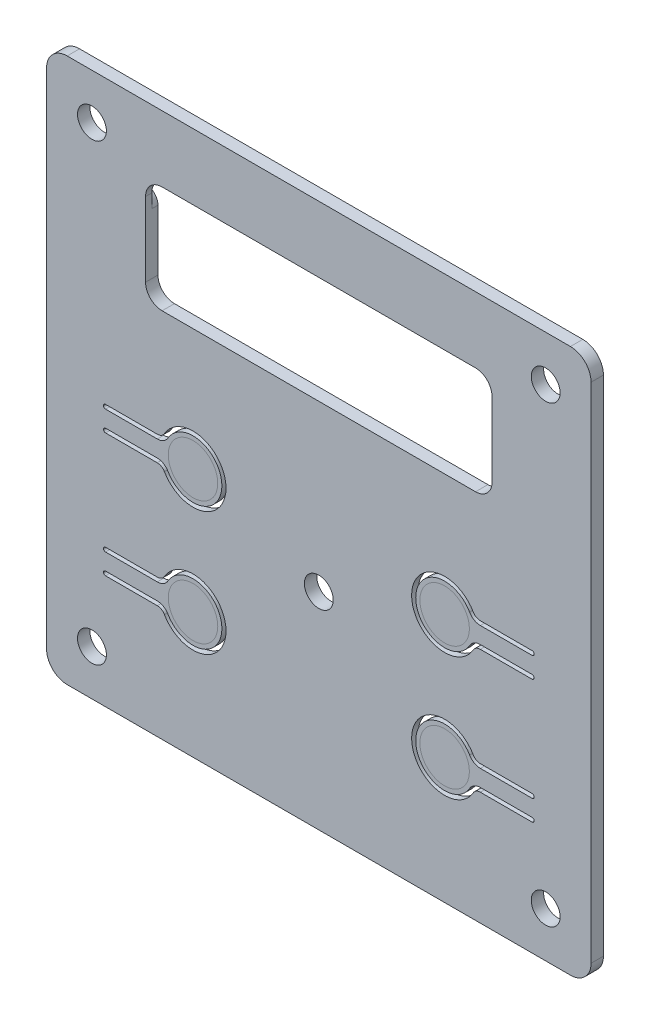
from build123d import *

# Parameters (mm, degrees)
SKETCH_1_W             = 132
SKETCH_1_H             = 132
SKETCH_1_R             = 3.5
EXTRUDE_1_DEPTH        = 3
FILLET_1_R             = 5
CUT_EXTRUDE_1_DEPTH    = 94.386294498
FILLET_2_R             = 0.5
FILLET_2_OF_MIRROR_1_R = 0.5
MIRROR_2_DEPTH         = 3
CUT_EXTRUDE_START      = -1.450001
SKETCH_4_R             = 12.5
CUT_EXTRUDE_2_DEPTH    = 1.450001
CUT_EXTRUDE_START_2    = -1.450002
CUT_EXTRUDE_3_DEPTH    = 1.450002
FILLET_3_R             = 1
CUT_EXTRUDE_4_DEPTH    = 94.386294498
SKETCH_7_R             = 4
CUT_EXTRUDE_5_DEPTH    = 1.5
FILLET_4_R             = 3


# Read off the part's stored shape, not the designer's step: Зеркальное отражение2
# Some blends are built 0.0001 mm under size
with BuildPart() as part:
    # Эскиз1 → Бобышка-Вытянуть1 (new body)
    with BuildSketch(Plane.XY):
        Rectangle(SKETCH_1_W, SKETCH_1_H)
        with Locations((-55, 55)):
            Circle(SKETCH_1_R, mode=Mode.SUBTRACT)
        with Locations((55, 55)):
            Circle(SKETCH_1_R, mode=Mode.SUBTRACT)
        with Locations((55, -55)):
            Circle(SKETCH_1_R, mode=Mode.SUBTRACT)
        with Locations((-55, -55)):
            Circle(SKETCH_1_R, mode=Mode.SUBTRACT)
        with Locations((0, -16)):
            Circle(SKETCH_1_R, mode=Mode.SUBTRACT)
    extrude(amount=EXTRUDE_1_DEPTH)

    # Скругление1
    fillet_1_edges = [part.edges().sort_by_distance(p)[0] for p in [
        (-66, 66, 1.5),
        (66, 66, 1.5),
        (66, -66, 1.5),
        (-66, -66, 1.5),
    ]]
    fillet(fillet_1_edges, radius=FILLET_1_R)

    # Эскиз3 → Вырез-Вытянуть1 (cut, through all)
    with BuildSketch(Plane.XY.offset(3)):
        with BuildLine():
            Line((-39.160131968, -3.499931335), (-52.208081862, -3.499931335))
            Line((-52.208081862, -3.499931335), (-52.208081862, -2.499931335))
            Line((-52.208081862, -2.499931335), (-39.160131968, -2.499931335))
            ThreePointArc((-39.160131968, -2.499931335), (-38.160131968, -2.231982143), (-37.42808116, -1.499931335))
            ThreePointArc((-37.42808116, -1.499931335), (-22.49987793, -5.499931335), (-37.42808116, -9.499931335))
            ThreePointArc((-37.42808116, -9.499931335), (-38.160131968, -8.767880528), (-39.160131968, -8.499931335))
            Line((-39.160131968, -8.499931335), (-52.208081862, -8.499931335))
            Line((-52.208081862, -8.499931335), (-52.208081862, -7.499931335))
            Line((-52.208081862, -7.499931335), (-39.160131968, -7.499931335))
            ThreePointArc((-39.160131968, -7.499931335), (-37.660131968, -7.901855124), (-36.562055756, -8.999931335))
            ThreePointArc((-36.562055756, -8.999931335), (-23.49987793, -5.499931335), (-36.562055756, -1.999931335))
            ThreePointArc((-36.562055756, -1.999931335), (-37.660131968, -3.098007547), (-39.160131968, -3.499931335))
        make_face()
    cut_extrude_1 = extrude(amount=-CUT_EXTRUDE_1_DEPTH, mode=Mode.SUBTRACT)

    # Скругление2
    fillet_2_edges = [part.edges().sort_by_distance(p)[0] for p in [
        (-52.208081862, -7.499931335, 1.5),
        (-52.208081862, -2.499931335, 1.5),
        (-52.208081862, -8.499931335, 1.5),
        (-52.208081862, -3.499931335, 1.5),
    ]]
    fillet(fillet_2_edges, radius=FILLET_2_R - 0.0001)  # a hair under: the kernel refuses the full size

    # Зеркальное отражение1: Вырез-Вытянуть1 across plane
    add(cut_extrude_1.mirror(Plane(origin=(0, 0, 0), x_dir=(0, 0, 1), z_dir=(1, 0, 0))), mode=Mode.SUBTRACT)

    # Скругление2 of Зеркальное отражение1
    fillet_2_of_mirror_1_edges = [part.edges().sort_by_distance(p)[0] for p in [
        (52.208081862, -7.499931335, 1.5),
        (52.208081862, -2.499931335, 1.5),
        (52.208081862, -8.499931335, 1.5),
        (52.208081862, -3.499931335, 1.5),
    ]]
    fillet(fillet_2_of_mirror_1_edges, radius=FILLET_2_OF_MIRROR_1_R - 0.0001)  # a hair under: the kernel refuses the full size

    # Зеркальное отражение2 outline → Зеркальное отражение2 (cut)
    with BuildSketch(Plane.XY):
        with BuildLine():
            ThreePointArc((37.427771906, -39.501176165), (38.159834629, -38.769137272), (39.15983899, -38.501204355))
            Line((39.15983899, -38.501204355), (51.707788883, -38.501408585))
            ThreePointArc((51.707788883, -38.501408585), (52.061344657, -38.354967731), (52.207797021, -38.001416724))
            ThreePointArc((52.207797021, -38.001416724), (52.061356166, -37.647860949), (51.707805159, -37.501408586))
            Line((51.707805159, -37.501408586), (39.159855266, -37.501204356))
            ThreePointArc((39.159855266, -37.501204356), (37.659848724, -37.90310373), (36.561754641, -39.001162069))
            ThreePointArc((36.561754641, -39.001162069), (23.499633782, -35.500949469), (36.561868573, -32.00116207))
            ThreePointArc((36.561868573, -32.00116207), (37.659926912, -33.099256154), (39.15992037, -33.501204356))
            Line((39.15992037, -33.501204356), (51.707870263, -33.501408586))
            ThreePointArc((51.707870263, -33.501408586), (52.061426037, -33.354967731), (52.207878401, -33.001416724))
            ThreePointArc((52.207878401, -33.001416724), (52.061437546, -32.64786095), (51.707886539, -32.501408586))
            Line((51.707886539, -32.501408586), (39.159936646, -32.501204356))
            ThreePointArc((39.159936646, -32.501204356), (38.159941007, -32.233238888), (37.427902114, -31.501176166))
            ThreePointArc((37.427902114, -31.501176166), (22.499633782, -35.500933194), (37.427771906, -39.501176165))
        make_face()
        with BuildLine():
            Line((-51.708374828, -38.499725387), (-39.160424935, -38.499929618))
            ThreePointArc((-39.160424935, -38.499929618), (-38.160429296, -38.767895086), (-37.428390404, -39.499957808))
            ThreePointArc((-37.428390404, -39.499957808), (-22.500122071, -35.50020078), (-37.428260196, -31.499957809))
            ThreePointArc((-37.428260196, -31.499957809), (-38.160322918, -32.231996702), (-39.160327279, -32.499929618))
            Line((-39.160327279, -32.499929618), (-51.708277172, -32.499725388))
            ThreePointArc((-51.708277172, -32.499725388), (-52.061832946, -32.646166243), (-52.20828531, -32.99971725))
            ThreePointArc((-52.20828531, -32.99971725), (-52.061844455, -33.353273024), (-51.708293448, -33.499725388))
            Line((-51.708293448, -33.499725388), (-39.160343555, -33.499929618))
            ThreePointArc((-39.160343555, -33.499929618), (-37.660337014, -33.098030244), (-36.56224293, -31.999971905))
            ThreePointArc((-36.56224293, -31.999971905), (-23.500122071, -35.500184505), (-36.562356862, -38.999971904))
            ThreePointArc((-36.562356862, -38.999971904), (-37.660415201, -37.90187782), (-39.160408659, -37.499929618))
            Line((-39.160408659, -37.499929618), (-51.708358552, -37.499725388))
            ThreePointArc((-51.708358552, -37.499725388), (-52.061914326, -37.646166243), (-52.20836669, -37.99971725))
            ThreePointArc((-52.20836669, -37.99971725), (-52.061925835, -38.353273024), (-51.708374828, -38.499725387))
        make_face()
    extrude(amount=MIRROR_2_DEPTH, mode=Mode.SUBTRACT)

    # Эскиз4 → Вырез-Вытянуть2 (cut)
    with BuildSketch(Plane(origin=(0, 0, 0), x_dir=(-1, 0, 0), z_dir=(0, 0, -1)).offset(CUT_EXTRUDE_START)):
        with Locations((-30.49987793, -5.499931335)):
            Circle(SKETCH_4_R)
        with Locations((30.50012207, -5.499931335)):
            Circle(SKETCH_4_R)
        with Locations((-30.49987793, -35.500070572)):
            Circle(SKETCH_4_R)
        with Locations((30.50012207, -35.500070572)):
            Circle(SKETCH_4_R)
    extrude(amount=CUT_EXTRUDE_2_DEPTH, mode=Mode.SUBTRACT)

    # Эскиз5 → Вырез-Вытянуть3 (cut)
    with BuildSketch(Plane(origin=(0, 0, 0), x_dir=(-1, 0, 0), z_dir=(0, 0, -1)).offset(CUT_EXTRUDE_START_2)):
        with BuildLine():
            Line((13.924942017, -57.375100136), (8.924942017, -57.375100136))
            ThreePointArc((8.924942017, -57.375100136), (7.174942017, -55.625100136), (8.924942017, -53.875100136))
            Line((8.924942017, -53.875100136), (13.924942017, -53.875100136))
            ThreePointArc((13.924942017, -53.875100136), (15.674942017, -55.625100136), (13.924942017, -57.375100136))
        make_face()
        with BuildLine():
            Line((-2.074954987, -58.825081825), (-4.574954987, -58.825081825))
            ThreePointArc((-4.574954987, -58.825081825), (-6.324954987, -57.075081825), (-4.574954987, -55.325081825))
            Line((-4.574954987, -55.325081825), (-2.074954987, -55.325081825))
            ThreePointArc((-2.074954987, -55.325081825), (-0.324954987, -57.075081825), (-2.074954987, -58.825081825))
        make_face()
        with BuildLine():
            Line((-47.02500206, -33.149315929), (-47.02500206, -40.769315929))
            ThreePointArc((-47.02500206, -40.769315929), (-48.775001727, -42.519316262), (-50.52500206, -40.769315929))
            Line((-50.52500206, -40.769315929), (-50.52500206, -33.149315929))
            ThreePointArc((-50.52500206, -33.149315929), (-48.77500206, -31.399315929), (-47.02500206, -33.149315929))
        make_face()
        with BuildLine():
            Line((-53.130997525, -33.09477642), (-55.670997525, -33.09477642))
            ThreePointArc((-55.670997525, -33.09477642), (-57.420997747, -31.344776642), (-55.670997525, -29.59477642))
            Line((-55.670997525, -29.59477642), (-53.130997525, -29.59477642))
            ThreePointArc((-53.130997525, -29.59477642), (-51.380997525, -31.34477642), (-53.130997525, -33.09477642))
        make_face()
        with BuildLine():
            Line((-11, -11.46), (-13.54, -11.46))
            ThreePointArc((-13.54, -11.46), (-14.954213562, -12.045786438), (-15.54, -13.46))
            Line((-15.54, -13.46), (-15.54, -18.54))
            ThreePointArc((-15.54, -18.54), (-14.954213562, -19.954213562), (-13.54, -20.54))
            Line((-13.54, -20.54), (-11, -20.54))
            ThreePointArc((-11, -20.54), (-9.585786438, -19.954213562), (-9, -18.54))
            Line((-9, -18.54), (-9, -13.46))
            ThreePointArc((-9, -13.46), (-9.585786438, -12.045786438), (-11, -11.46))
        make_face()
        with BuildLine():
            Line((-33, -46.6), (-44, -46.6))
            ThreePointArc((-44, -46.6), (-45.414213562, -47.185786438), (-46, -48.6))
            Line((-46, -48.6), (-46, -51))
            ThreePointArc((-46, -51), (-45.414213562, -52.414213562), (-44, -53))
            Line((-44, -53), (-33, -53))
            ThreePointArc((-33, -53), (-31.585786438, -52.414213562), (-31, -51))
            Line((-31, -51), (-31, -48.6))
            ThreePointArc((-31, -48.6), (-31.585786438, -47.185786438), (-33, -46.6))
        make_face()
        with BuildLine():
            Line((-14.96, -28.25), (-17.5, -28.25))
            ThreePointArc((-17.5, -28.25), (-19.25, -26.5), (-17.5, -24.75))
            Line((-17.5, -24.75), (-14.96, -24.75))
            ThreePointArc((-14.96, -24.75), (-13.21, -26.5), (-14.96, -28.25))
        make_face()
        with BuildLine():
            Line((57, -3), (54.5, -3))
            ThreePointArc((54.5, -3), (53.085786438, -3.585786438), (52.5, -5))
            Line((52.5, -5), (52.5, -22))
            ThreePointArc((52.5, -22), (53.085786438, -23.414213562), (54.5, -24))
            Line((54.5, -24), (57, -24))
            ThreePointArc((57, -24), (58.414213562, -23.414213562), (59, -22))
            Line((59, -22), (59, -5))
            ThreePointArc((59, -5), (58.414213562, -3.585786438), (57, -3))
        make_face()
        with BuildLine():
            Line((56.5, -33.7), (54.5, -33.7))
            ThreePointArc((54.5, -33.7), (53.792893219, -33.992893219), (53.5, -34.7))
            Line((53.5, -34.7), (53.5, -40))
            ThreePointArc((53.5, -40), (53.792893219, -40.707106781), (54.5, -41))
            Line((54.5, -41), (56.5, -41))
            ThreePointArc((56.5, -41), (57.207106781, -40.707106781), (57.5, -40))
            Line((57.5, -40), (57.5, -34.7))
            ThreePointArc((57.5, -34.7), (57.207106781, -33.992893219), (56.5, -33.7))
        make_face()
    extrude(amount=CUT_EXTRUDE_3_DEPTH, mode=Mode.SUBTRACT)

    # Скругление3
    # the kernel refuses this fillet: 1 mm, written as the material it takes off along each edge
    with BuildSketch(Plane(origin=(36.248057354, -46.6, -8.023946044), x_dir=(0.8243834141598411, 0.56603178926467, 0), z_dir=(0, 0, 1))) as fillet_3_piece_1:
        with BuildLine():
            CenterArc((3.211955003, -0.99234), FILLET_3_R, 97.096261685, 138.429767002)
            Line((2.645923214, -1.816723414), (0, 0))
            ThreePointArc((0, 0), (1.544209136, -0.095749997), (3.088418272, 0))
        make_face()
    extrude(amount=9.473947044, mode=Mode.SUBTRACT)
    with BuildSketch(Plane(origin=(31.096639866, -47.985817453, -2.64906775), x_dir=(-0.09571801201142088, -0.9954084901067407, 0), z_dir=(0, 0, 1))) as fillet_3_piece_2:
        with BuildLine():
            CenterArc((1.105348948, -0.99540849), FILLET_3_R, 95.492647202, 87.877967076)
            Line((0.107078834, -1.054202881), (0.007251823, -1.06008232))
            ThreePointArc((0.007251823, -1.06008232), (-0.034773043, -0.536071626), (-0.098970381, -0.014313062))
            Line((-0.098970381, -0.014313062), (0.021458834, 0.097670458))
            ThreePointArc((0.021458834, 0.097670458), (0.611040896, 0.062133038), (1.000059135, 0.099540849))
            Line((1.000059135, 0.099540849), (1.009630936, 0))
        make_face()
    extrude(amount=4.09906875, mode=Mode.SUBTRACT)

    # Эскиз6 → Вырез-Вытянуть4 (cut, through all)
    with BuildSketch(Plane.XY.offset(3)):
        with BuildLine():
            Line((38, 50), (-38, 50))
            ThreePointArc((-38, 50), (-40.828427125, 48.828427125), (-42, 46))
            Line((-42, 46), (-42, 28))
            ThreePointArc((-42, 28), (-40.828427125, 25.171572875), (-38, 24))
            Line((-38, 24), (38, 24))
            ThreePointArc((38, 24), (40.828427125, 25.171572875), (42, 28))
            Line((42, 28), (42, 46))
            ThreePointArc((42, 46), (40.828427125, 48.828427125), (38, 50))
        make_face()
    extrude(amount=-CUT_EXTRUDE_4_DEPTH, mode=Mode.SUBTRACT)

    # Эскиз7 → Вырез-Вытянуть5 (cut)
    with BuildSketch(Plane(origin=(0, 0, 0), x_dir=(-1, 0, 0), z_dir=(0, 0, -1))):
        with Locations((43.5, 20.5)):
            Circle(SKETCH_7_R)
        with Locations((43.5, 49.5)):
            Circle(SKETCH_7_R)
        with Locations((-43.5, 49.5)):
            Circle(SKETCH_7_R)
        with Locations((-43.5, 20.5)):
            Circle(SKETCH_7_R)
    extrude(amount=-CUT_EXTRUDE_5_DEPTH, mode=Mode.SUBTRACT)

    # Скругление4
    # the kernel refuses this fillet: 3 mm, written as the material it takes off along each edge
    with BuildSketch(Plane(origin=(-39.505305376, 49.705948694, -5.220723708), x_dir=(-0.28360785486299994, 0.9589403446826124, 0), z_dir=(0, 0, 1))) as fillet_4_piece_1:
        with BuildLine():
            CenterArc((2.572444218, -2.91681188), FILLET_4_R, 103.524348664, 60)
            Line((-0.304376816, -2.065988315), (-0.592058919, -1.980905959))
            ThreePointArc((-0.592058919, -1.980905959), (-0.432620872, -1.44181096), (-0.298552511, -0.029434642))
            Line((-0.298552511, -0.029434642), (0.07015757, 0.291681188))
            ThreePointArc((0.07015757, 0.291681188), (0.935434261, 0.189082507), (1.800710953, 0.291681188))
            Line((1.800710953, 0.291681188), (1.870868523, 0))
        make_face()
    extrude(amount=6.720723708, mode=Mode.SUBTRACT)
    with BuildSketch(Plane(origin=(-42, 45.791900756, 1.5), x_dir=(0, -1, 0), z_dir=(0, 0, -1))) as fillet_4_piece_2:
        with BuildLine():
            CenterArc((3.129297922, 3), FILLET_4_R, 192.373625116, 77.626374884)
            ThreePointArc((0.198984851, 2.357142857), (0.277723749, 1.16352553), (0, 0))
            Line((0, 0), (3.129297922, 0))
        make_face()
    extrude(amount=9.323244805, mode=Mode.SUBTRACT)
    with BuildSketch(Plane(origin=(42, 45.791900756, 1.5), x_dir=(0.9964557482249943, -0.08411861761445576, 0), z_dir=(0, 0, -1))) as fillet_4_piece_3:
        with BuildLine():
            CenterArc((3.25259946, 2.865851049), FILLET_4_R, 175.17465614, 77.626374884)
            Line((0.263232215, 3.118206902), (0, 0))
            ThreePointArc((0, 0), (1.18276344, 0.178865267), (2.36552688, 0))
        make_face()
    extrude(amount=9.323244805, mode=Mode.SUBTRACT)
    with BuildSketch(Plane(origin=(39.505305376, 49.705948694, -5.220723708), x_dir=(-0.9900366877989601, 0.14080964743959892, 0), z_dir=(0, 0, 1))) as fillet_4_piece_4:
        with BuildLine():
            CenterArc((2.510718425, -2.970110063), FILLET_4_R, 98.094699752, 60)
            Line((-0.272686813, -1.850889227), (-0.551027337, -1.738967143))
            ThreePointArc((-0.551027337, -1.738967143), (-0.323406671, -0.897885057), (-0.298792035, -0.026894608))
            Line((-0.298792035, -0.026894608), (0.072635566, 0.291074002))
            ThreePointArc((0.072635566, 0.291074002), (1.489469916, 0.217850945), (2.046046589, 0.297011006))
            Line((2.046046589, 0.297011006), (2.088289483, 0))
        make_face()
    extrude(amount=6.720723708, mode=Mode.SUBTRACT)


solid = part.part
